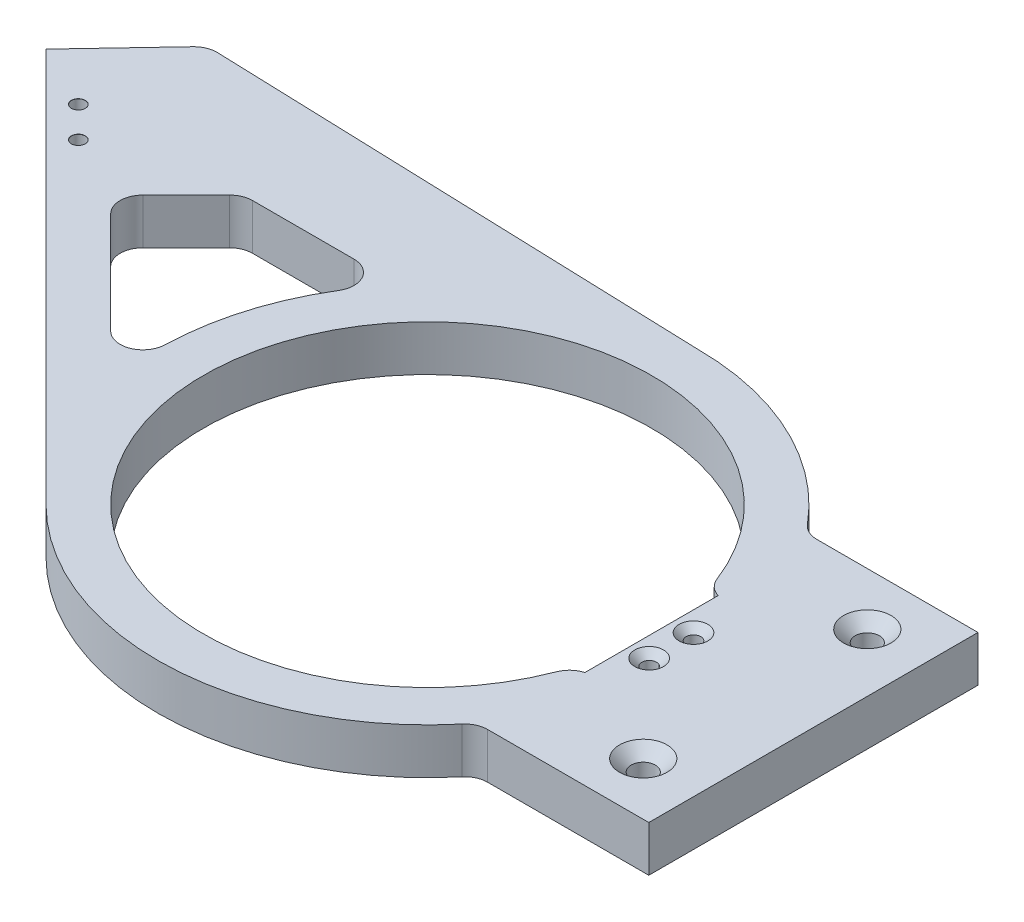
from build123d import *

# Parameters (mm, degrees)
BOSS_EXTRUDE1_DEPTH                             = 5
FILLET1_R                                       = 5
CUT_EXTRUDE1_DEPTH                              = 10
F_3_0MM_PRESS_DOWEL_HOLE2_D                     = 3
F_3_0MM_PRESS_DOWEL_HOLE2_CSINK_D               = 3.05
F_3_0MM_PRESS_DOWEL_HOLE2_CSINK_ANGLE           = 90
CUT_EXTRUDE2_DEPTH                              = 5
CSK_FOR_M3_FLAT_HEAD_MACHINE_SCREW2_D           = 3.2
CSK_FOR_M3_FLAT_HEAD_MACHINE_SCREW2_CSINK_D     = 6.3
CSK_FOR_M3_FLAT_HEAD_MACHINE_SCREW2_CSINK_ANGLE = 90


with BuildPart() as part:
    # Sketch1 → Boss-Extrude1 (new, symmetric)
    with BuildSketch(Plane(origin=(0, 0, 0), x_dir=(1, 0, 0), z_dir=(0, 1, 0))):
        with BuildLine():
            Line((-107.462553071, 24.023952891), (-41.71930009, -41.71930009))
            ThreePointArc((-41.71930009, -41.71930009), (3.806502253, -58.877079926), (46.74398357, -36))
            Line((46.74398357, -36), (84.4, -36))
            Line((84.4, -36), (84.4, 36))
            Line((84.4, 36), (46.74398357, 36))
            ThreePointArc((46.74398357, 36), (26.048032555, 52.93864373), (0, 59))
            Line((0, 59), (-110.83863918, 62.740943777))
            Line((-110.83863918, 62.740943777), (-128.004005064, 44.565404884))
            Line((-128.004005064, 44.565404884), (-107.462553071, 24.023952891))
        make_face()
        with BuildLine():
            Line((49, 14.576290822), (46.781745862, 14.576290822))
            ThreePointArc((46.781745862, 14.576290822), (-49, 0), (46.781745862, -14.576290822))
            Line((46.781745862, -14.576290822), (49, -14.576290822))
            Line((49, -14.576290822), (49, 14.576290822))
        make_face(mode=Mode.SUBTRACT)
        with BuildLine():
            Line((-93.296148974, 23.999684418), (-57.886132355, -11.410332201))
            ThreePointArc((-57.886132355, -11.410332201), (-57.048958802, 15.047135926), (-44.728269399, 38.475731527))
            Line((-44.728269399, 38.475731527), (-78.820101865, 38.475731527))
            Line((-78.820101865, 38.475731527), (-93.296148974, 23.999684418))
        make_face(mode=Mode.SUBTRACT)
    extrude(amount=BOSS_EXTRUDE1_DEPTH, both=True)

    # Fillet1
    # the kernel refuses this fillet: 5 mm, written as the material it adds along each edge
    with BuildSketch(Plane(origin=(46.74398357, -5, 36), x_dir=(1, 0, 0), z_dir=(0, 1, 0))) as fillet1_piece_1:
        with BuildLine():
            CenterArc((2.398665931, -5), FILLET1_R, 90, 50.161560023)
            ThreePointArc((-1.440603561, -1.796875), (-0.711533327, -0.905467408), (0, 0))
            Line((0, 0), (2.398665931, 0))
        make_face()
    extrude(amount=10)
    with BuildSketch(Plane(origin=(46.74398357, -5, -36), x_dir=(-0.6255163967442842, 0, -0.7802110210731757), z_dir=(0, 1, 0))) as fillet1_piece_2:
        with BuildLine():
            CenterArc((2.400650235, -4.999047579), FILLET1_R, 91.118340331, 50.161560023)
            Line((-1.50040487, -1.871465595), (0, 0))
            ThreePointArc((0, 0), (1.151531414, -0.011238567), (2.303062827, 0))
        make_face()
    extrude(amount=10)
    with BuildSketch(Plane(origin=(-93.296148974, -5, -23.999684418), x_dir=(0.7071067811865472, 0, -0.7071067811865479), z_dir=(0, 1, 0))) as fillet1_piece_3:
        with BuildLine():
            CenterArc((FILLET1_R, -FILLET1_R), FILLET1_R, 90, 90)
            Line((0, -FILLET1_R), (0, 0))
            Line((0, 0), (FILLET1_R, 0))
        make_face()
    extrude(amount=10)
    with BuildSketch(Plane(origin=(-78.820101865, -5, -38.475731527), x_dir=(1, 0, 0), z_dir=(0, 1, 0))) as fillet1_piece_4:
        with BuildLine():
            CenterArc((FILLET1_R * 0.414213562373, -FILLET1_R), FILLET1_R, 90, 45)
            Line((-FILLET1_R * 0.292893218813, -FILLET1_R * 0.292893218813), (0, 0))
            Line((0, 0), (FILLET1_R * 0.414213562373, 0))
        make_face()
    extrude(amount=10)
    with BuildSketch(Plane(origin=(-57.886132355, -5, 11.410332201), x_dir=(-0.7071067811865467, 0, -0.7071067811865482), z_dir=(0, 1, 0))) as fillet1_piece_5:
        with BuildLine():
            CenterArc((13.612446704, -5), FILLET1_R, 90, 133.432536558)
            ThreePointArc((9.981524817, -8.4375), (5.225121697, -3.941504009), (0, 0))
            Line((0, 0), (13.612446704, 0))
        make_face()
    extrude(amount=10)
    with BuildSketch(Plane(origin=(-44.728269399, 5, -38.475731527), x_dir=(-1, 0, 0), z_dir=(0, -1, 0))) as fillet1_piece_6:
        with BuildLine():
            CenterArc((9.81873234, -5), FILLET1_R, 90, 121.53762105)
            ThreePointArc((5.557247829, -7.615291526), (2.930969774, -3.696471595), (0, 0))
            Line((0, 0), (9.81873234, 0))
        make_face()
    extrude(amount=10)
    # the kernel refuses this fillet: 5 mm, written as the material it takes off along each edge
    with BuildSketch(Plane(origin=(46.781745862, 12.95259813, 14.576290822), x_dir=(-0.32830869078175484, 0, 0.9445704862831413), z_dir=(0, -1, 0)), Plane(origin=(46.781745862, -12.95259813, -14.576290822), x_dir=(-0.32830869078175745, 0, -0.9445704862831404), z_dir=(0, 1, 0))) as fillet1_2_piece_1:
        with BuildLine():
            CenterArc((3.343337173, -4.997365244), FILLET1_R, 91.860123923, 52.660239811)
            Line((-0.728272112, -2.09529739), (0, 0))
            ThreePointArc((0, 0), (1.590519626, -0.025820606), (3.181039252, 0))
        make_face()
    extrude(amount=25.90519626, mode=Mode.SUBTRACT)
    with BuildSketch(Plane(origin=(-110.83863918, 10.640073082, -62.740943777), x_dir=(-0.6866146353868613, 0, 0.7270215557138366), z_dir=(0, -1, 0))) as fillet1_2_piece_2:
        with BuildLine():
            CenterArc((FILLET1_R * 0.451205846565, -FILLET1_R), FILLET1_R, 90, 48.570349235)
            Line((-FILLET1_R * 0.298562891452, -FILLET1_R * 0.338300038165), (0, 0))
            Line((0, 0), (FILLET1_R * 0.451205846565, 0))
        make_face()
    extrude(amount=21.280146164, mode=Mode.SUBTRACT)

    # Sketch11 → Cut-Extrude1 (cut)
    with BuildSketch(Plane(origin=(-41.71930009, 0, 41.71930009), x_dir=(0.7071067811865458, 0, 0.7071067811865492), z_dir=(-0.7071067811865492, 0, 0.7071067811865458))):
        Polygon((-116.982839598, -5), (-116.982839598, -2.5), (-119.982839598, -2.5), (-119.982839598, 2.5), (-84.982839598, 2.5), (-84.982839598, -2.5), (-87.982839598, -2.5), (-87.982839598, -5), align=None)
    extrude(amount=-CUT_EXTRUDE1_DEPTH, mode=Mode.SUBTRACT)

    # Ø3.0mm Press Dowel Hole2 (through all)
    with Locations(Plane(origin=(-114.00883423, 5, -37.641301862), x_dir=(0, 0, 1), z_dir=(0, 1, 0))):
        with Locations((0, 0), (6.717514422, 6.717514421)):
            CounterSinkHole(F_3_0MM_PRESS_DOWEL_HOLE2_D / 2, F_3_0MM_PRESS_DOWEL_HOLE2_CSINK_D / 2, counter_sink_angle=F_3_0MM_PRESS_DOWEL_HOLE2_CSINK_ANGLE)

    # Sketch15 → Cut-Extrude2 (cut)
    with BuildSketch(Plane(origin=(0, -5, 0), x_dir=(-1, 0, 0), z_dir=(0, -1, 0))):
        Polygon((-49, -14.576290822), (-54, -14.576290822), (-54, -19.5), (-59, -19.5), (-59, 19.5), (-54, 19.5), (-54, 14.576290822), (-49, 14.576290822), align=None)
    extrude(amount=-CUT_EXTRUDE2_DEPTH, mode=Mode.SUBTRACT)

    # CSK for M3 Flat Head Machine Screw2 (through all)
    with Locations(Plane(origin=(53.32762779, 5, -4.850211012), x_dir=(0, 0, 1), z_dir=(0, 1, 0))):
        with Locations((0, 0), (9.700422024, 0)):
            CounterSinkHole(CSK_FOR_M3_FLAT_HEAD_MACHINE_SCREW2_D / 2, CSK_FOR_M3_FLAT_HEAD_MACHINE_SCREW2_CSINK_D / 2, counter_sink_angle=CSK_FOR_M3_FLAT_HEAD_MACHINE_SCREW2_CSINK_ANGLE)

    # CSK for M5 Flat Head Machine Screw2: read off the stored shape, not the designer's step
    # CSK for M5 Flat Head Machine Screw2 outl → CSK for M5 Flat Head Machine Screw2 (revolve, cut)
    with BuildSketch(Plane(origin=(71.691354027, 0, 24.5), x_dir=(1, 0, 0), z_dir=(0, 0, 1))):
        Polygon((0, -5), (2.65, -5), (2.65, 2.45), (5.2, 5), (0, 5), align=None)
    revolve(axis=Axis((71.691354027, 0, 24.5), (0, 1, 0)), mode=Mode.SUBTRACT)

    # CSK for M5 Flat Head Machine Screw2 2 ou → CSK for M5 Flat Head Machine Screw2 2 (revolve, cut)
    with BuildSketch(Plane(origin=(71.691354027, 0, -24.5), x_dir=(1, 0, 0), z_dir=(0, 0, 1))):
        Polygon((0, -5), (2.65, -5), (2.65, 2.45), (5.2, 5), (0, 5), align=None)
    revolve(axis=Axis((71.691354027, 0, -24.5), (0, 1, 0)), mode=Mode.SUBTRACT)


solid = part.part
